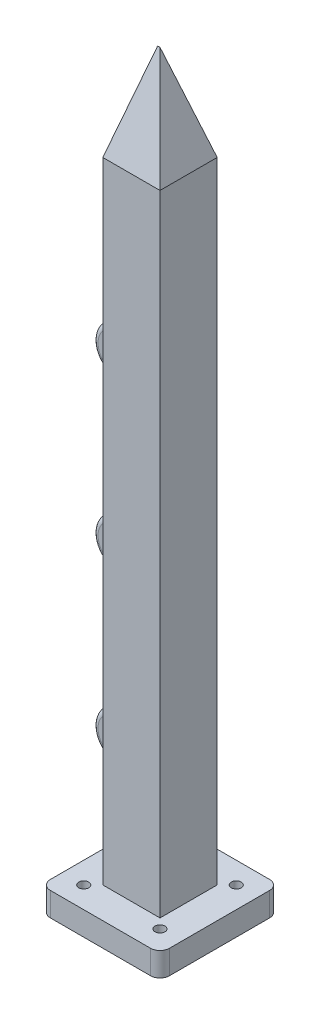
from build123d import *

# Parameters (mm, degrees)
SKETCH1_W                = 25
SKETCH1_H                = 25
BOSS_EXTRUDE1_DEPTH      = 5
SKETCH2_R                = 1.05
CUT_EXTRUDE1_DEPTH       = 5
FILLET1_R                = 2
SKETCH3_W                = 12
SKETCH3_H                = 12
BOSS_EXTRUDE2_DEPTH      = 152.2
SKETCH4_W                = 5
SKETCH4_H                = 5
CUT_EXTRUDE2_DEPTH       = 140
SKETCH5_W                = 5
SKETCH5_H                = 5
BOSS_EXTRUDE3_DEPTH      = 20
CUT_EXTRUDE6_DEPTH       = 20
CUT_EXTRUDE7_DEPTH       = 20
BOSS_EXTRUDE4_DEPTH      = 3
BOSS_EXTRUDE4_DEPTH_BACK = 3
BOSS_EXTRUDE4_START      = -6
SKETCH12_R               = 5
SKETCH12_R_2             = 1
FILLET2_R                = 1
CUT_EXTRUDE8_DEPTH       = 15


with BuildPart() as part:
    # Sketch1 → Boss-Extrude1 (new body)
    with BuildSketch(Plane(origin=(0, 0, 0), x_dir=(1, 0, 0), z_dir=(0, 1, 0))):
        with Locations((12.5, 12.5)):
            Rectangle(SKETCH1_W, SKETCH1_H)
    extrude(amount=BOSS_EXTRUDE1_DEPTH)

    # Sketch2 → Cut-Extrude1 (cut)
    with BuildSketch(Plane(origin=(0, 5, 0), x_dir=(1, 0, 0), z_dir=(0, 1, 0))):
        with Locations(Location((4.5, 4.5, 0), (0, 0, 270))):
            Circle(SKETCH2_R)
        with Locations(Location((20.5, 4.5, 0), (0, 0, 270))):
            Circle(SKETCH2_R)
        with Locations(Location((20.5, 20.5, 0), (0, 0, 270))):
            Circle(SKETCH2_R)
        with Locations(Location((4.5, 20.5, 0), (0, 0, 270))):
            Circle(SKETCH2_R)
    extrude(amount=-CUT_EXTRUDE1_DEPTH, mode=Mode.SUBTRACT)

    # Fillet1
    fillet1_edges = [part.edges().sort_by_distance(p)[0] for p in [
        (0, 2.5, -25),
        (25, 2.5, -25),
        (25, 2.5, 0),
        (0, 2.5, 0),
    ]]
    fillet(fillet1_edges, radius=FILLET1_R)

    # Sketch3 → Boss-Extrude2 (add)
    with BuildSketch(Plane(origin=(0, 5, 0), x_dir=(1, 0, 0), z_dir=(0, 1, 0))):
        with Locations((12.5, 12.5)):
            Rectangle(SKETCH3_W, SKETCH3_H)
    extrude(amount=BOSS_EXTRUDE2_DEPTH)

    # Sketch4 → Cut-Extrude2 (cut)
    with BuildSketch(Plane(origin=(0, 157.2, 0), x_dir=(1, 0, 0), z_dir=(0, 1, 0))):
        with Locations((12.5, 12.5)):
            Rectangle(SKETCH4_W, SKETCH4_H)
    extrude(amount=-CUT_EXTRUDE2_DEPTH, mode=Mode.SUBTRACT)

    # Sketch5 → Boss-Extrude3 (add)
    with BuildSketch(Plane(origin=(0, 157.2, 0), x_dir=(1, 0, 0), z_dir=(0, 1, 0))):
        with Locations((12.5, 12.5)):
            Rectangle(SKETCH5_W, SKETCH5_H)
    extrude(amount=-BOSS_EXTRUDE3_DEPTH)

    # Sketch10 → Cut-Extrude6 (cut)
    with BuildSketch(Plane.ZY.offset(-6.5)):
        Polygon((-6.5, 137.2), (-6.5, 157.2), (-12.5, 157.2), align=None)
        Polygon((-18.5, 137.2), (-12.5, 157.2), (-18.5, 157.2), align=None)
    extrude(amount=-CUT_EXTRUDE6_DEPTH, mode=Mode.SUBTRACT)

    # Sketch11 → Cut-Extrude7 (cut)
    with BuildSketch(Plane.XY.offset(-6.5)):
        Polygon((6.5, 157.2), (6.5, 185), (12.5, 157.2), align=None)
        Polygon((18.5, 157.2), (12.5, 157.2), (18.5, 137.2), align=None)
    extrude(amount=-CUT_EXTRUDE7_DEPTH, mode=Mode.SUBTRACT)

    # Sketch12 → Boss-Extrude4 (add, two sides: drawn at the far end of the back side and taken through both)
    # profile 1 of 3: a face of its own
    with BuildSketch(Plane(origin=(0, 0, -18.5), x_dir=(-1, 0, 0), z_dir=(0, 0, -1)).offset(BOSS_EXTRUDE4_START - BOSS_EXTRUDE4_DEPTH_BACK)):
        with Locations((-6.5, 30)):
            Circle(SKETCH12_R)
        with Locations((-4.5, 30)):
            Circle(SKETCH12_R_2, mode=Mode.SUBTRACT)
    # profile 2 of 3: a face of its own
    with BuildSketch(Plane(origin=(0, 0, -18.5), x_dir=(-1, 0, 0), z_dir=(0, 0, -1)).offset(BOSS_EXTRUDE4_START - BOSS_EXTRUDE4_DEPTH_BACK)):
        with Locations((-6.5, 65)):
            Circle(SKETCH12_R)
        with Locations((-4.5, 65)):
            Circle(SKETCH12_R_2, mode=Mode.SUBTRACT)
    # profile 3 of 3: a face of its own
    with BuildSketch(Plane(origin=(0, 0, -18.5), x_dir=(-1, 0, 0), z_dir=(0, 0, -1)).offset(BOSS_EXTRUDE4_START - BOSS_EXTRUDE4_DEPTH_BACK)):
        with Locations((-6.5, 100)):
            Circle(SKETCH12_R)
        with Locations((-4.5, 100)):
            Circle(SKETCH12_R_2, mode=Mode.SUBTRACT)
    extrude(amount=BOSS_EXTRUDE4_DEPTH + BOSS_EXTRUDE4_DEPTH_BACK)

    # Fillet2
    fillet2_edges = [part.edges().sort_by_distance(p)[0] for p in [
        (6.5, 30, -15.5),
        (6.5, 30, -9.5),
        (1.5, 30, -15.5),
        (1.5, 30, -9.5),
        (6.5, 25, -12.5),
        (6.5, 35, -12.5),
        (6.5, 65, -15.5),
        (6.5, 65, -9.5),
        (1.5, 65, -15.5),
        (1.5, 65, -9.5),
        (6.5, 60, -12.5),
        (6.5, 70, -12.5),
        (11.5, 100, -10),
        (6.5, 100, -15.5),
        (6.5, 100, -9.5),
        (1.5, 100, -15.5),
        (1.5, 100, -9.5),
        (6.5, 95, -12.5),
        (6.5, 105, -12.5),
    ]]
    fillet(fillet2_edges, radius=FILLET2_R - 0.0001)  # a hair under: the kernel refuses the full size

    # Sketch13 → Cut-Extrude8 (cut)
    with BuildSketch(Plane(origin=(0, 0, -18.5), x_dir=(-1, 0, 0), z_dir=(0, 0, -1))):
        Polygon((-6.5, 137.2), (-6.5, 157.2), (-12, 157.2), align=None)
    extrude(amount=-CUT_EXTRUDE8_DEPTH, mode=Mode.SUBTRACT)


solid = part.part
